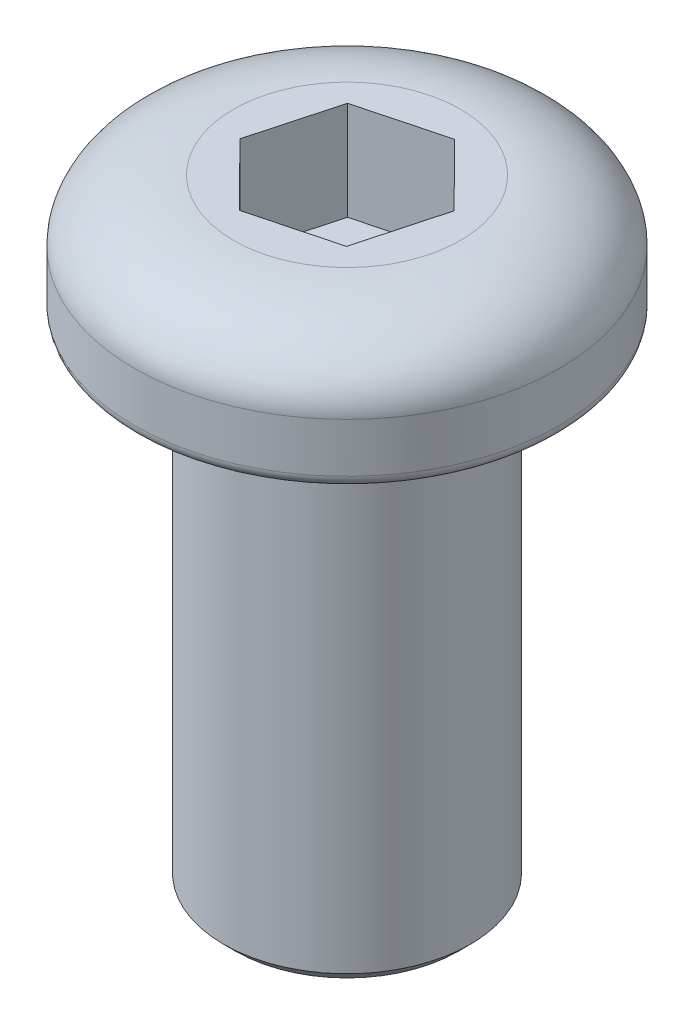
from build123d import *

# Parameters (mm, degrees)
SKETCH1_R           = 5
BOSS_EXTRUDE1_DEPTH = 20
SKETCH2_R           = 8.6
BOSS_EXTRUDE2_DEPTH = 5
FILLET1_SIZE        = 2.5
FILLET1_SIZE_2      = 4
CUT_EXTRUDE1_DEPTH  = 4
FILLET2_R           = 0.5
CHAMFER1_SIZE       = 0.5


with BuildPart() as part:
    # Sketch1 → Boss-Extrude1 (new body)
    with BuildSketch(Plane(origin=(0, 0, 0), x_dir=(1, 0, 0), z_dir=(0, 1, 0))):
        with Locations(Location((0, 0, 0), (0, 0, 270))):
            Circle(SKETCH1_R)
    extrude(amount=BOSS_EXTRUDE1_DEPTH)

    # Sketch2 → Boss-Extrude2 (add)
    with BuildSketch(Plane(origin=(0, 20, 0), x_dir=(1, 0, 0), z_dir=(0, 1, 0))):
        with Locations(Location((0, 0, 0), (0, 0, 270))):
            Circle(SKETCH2_R)
    extrude(amount=BOSS_EXTRUDE2_DEPTH)

    # Fillet1
    # an asymmetric fillet: 4, 2.5 mm, written as the material it takes off along each edge
    with BuildSketch(Plane(origin=(0, 25, 0), x_dir=(0, 0, 1), z_dir=(-1, 0, 0))) as fillet1_piece_1:
        with BuildLine():
            Bezier((8.6, -FILLET1_SIZE), (8.6, 0), (8.6 - FILLET1_SIZE_2, 0), weights=[1, 0.707106781, 1])
            Line((8.6 - FILLET1_SIZE_2, 0), (8.6, 0))
            Line((8.6, 0), (8.6, -FILLET1_SIZE))
        make_face()
    revolve(axis=Axis((0, 25, 0), (0, 1, 0)), mode=Mode.SUBTRACT)

    # Sketch3 → Cut-Extrude1 (cut)
    with BuildSketch(Plane(origin=(0, 25, 0), x_dir=(1, 0, 0), z_dir=(0, 1, 0))):
        Polygon((2.501014418, -2.520402127), (3.433239479, 0.905740958), (0.93222506, 3.426143085), (-2.501014418, 2.520402127), (-3.433239479, -0.905740958), (-0.93222506, -3.426143085), align=None)
    extrude(amount=-CUT_EXTRUDE1_DEPTH, mode=Mode.SUBTRACT)

    # Fillet2
    fillet2_edges = [part.edges().sort_by_distance(p)[0] for p in [
        (0, 20, -8.6),
    ]]
    fillet(fillet2_edges, radius=FILLET2_R)

    # Chamfer1
    chamfer1_edges = [part.edges().sort_by_distance(p)[0] for p in [
        (0, 0, -5),
    ]]
    chamfer(chamfer1_edges, length=CHAMFER1_SIZE)


solid = part.part
